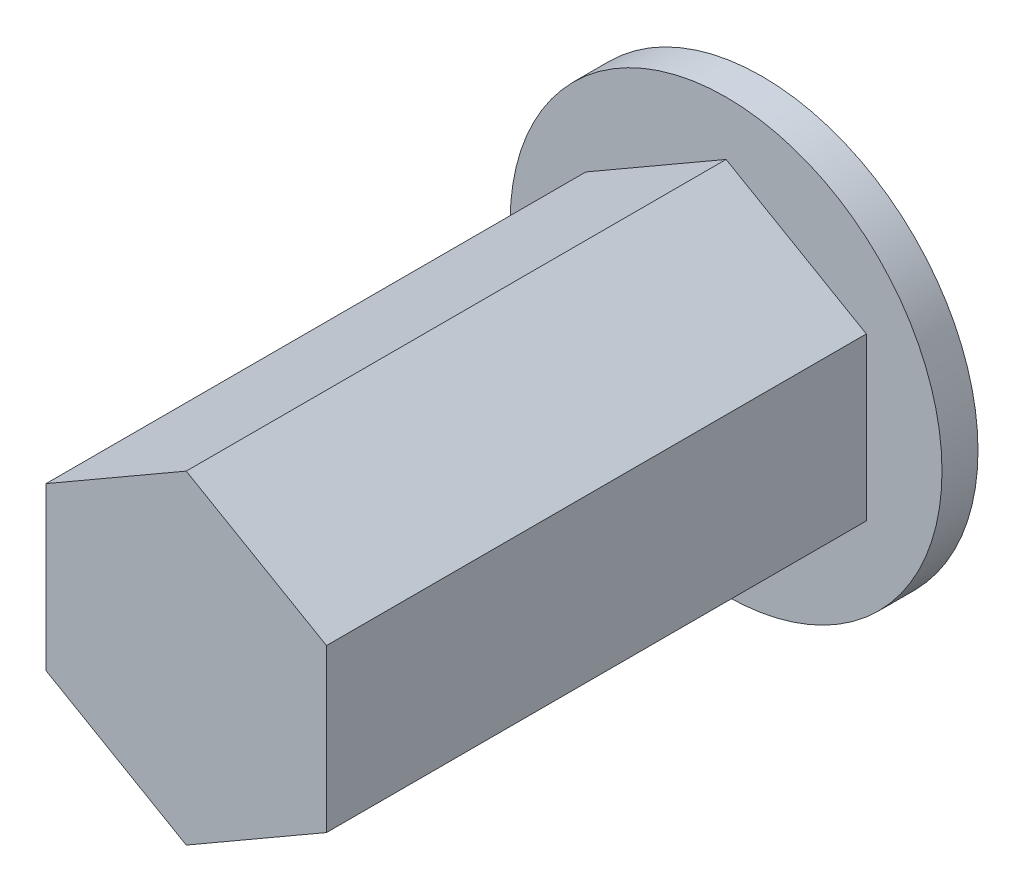
from build123d import *

# Parameters (mm, degrees)
SALIENTE_EXTRUIR1_DEPTH = 30
CROQUIS2_R              = 12
SALIENTE_EXTRUIR2_DEPTH = 2


with BuildPart() as part:
    # Croquis1 → Saliente-Extruir1 (new body)
    with BuildSketch(Plane.XY):
        Polygon((0, 9), (-7.794228634, 4.5), (-7.794228634, -4.5), (0, -9), (7.794228634, -4.5), (7.794228634, 4.5), align=None)
    extrude(amount=SALIENTE_EXTRUIR1_DEPTH)

    # Croquis2 → Saliente-Extruir2 (add)
    with BuildSketch(Plane(origin=(0, 0, 0), x_dir=(-1, 0, 0), z_dir=(0, 0, -1))):
        Circle(CROQUIS2_R)
    extrude(amount=SALIENTE_EXTRUIR2_DEPTH)


solid = part.part
